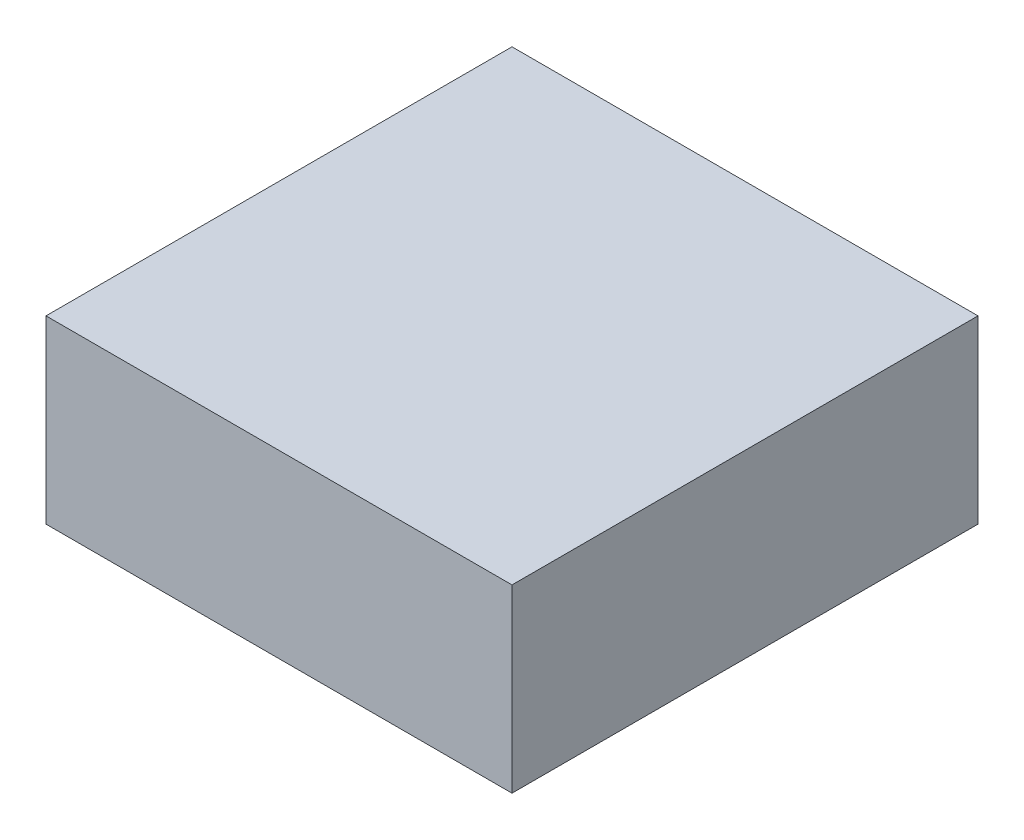
from build123d import *

# Parameters (mm, degrees)
SKETCH1_W             = 31
SKETCH1_H             = 31
BOSS_EXTRUDE1_DEPTH   = 12
CAVITY1_OUTLINE_W     = 27
CAVITY1_OUTLINE_H     = 27
CAVITY1_OUTLINE_W_2   = 23
CAVITY1_OUTLINE_H_2   = 23
CAVITY1_DEPTH         = 8
CAVITY1_2_OUTLINE_W   = 23
CAVITY1_2_OUTLINE_H   = 23
CAVITY1_2_OUTLINE_R   = 1.125
CAVITY1_2_DEPTH       = 2
CAVITY1_START         = 2
CAVITY1_3_OUTLINE_R   = 1.625
CAVITY1_3_OUTLINE_R_2 = 1.125
CAVITY1_3_DEPTH       = 1.2499999


with BuildPart() as part:
    # Sketch1 → Boss-Extrude1 (new body)
    with BuildSketch(Plane(origin=(0, 0, 0), x_dir=(1, 0, 0), z_dir=(0, 1, 0))):
        Rectangle(SKETCH1_W, SKETCH1_H)
    extrude(amount=BOSS_EXTRUDE1_DEPTH)

    # Cavity1: read off the stored shape, not the designer's step
    # Cavity1 outline → Cavity1 (cut)
    with BuildSketch(Plane(origin=(0, 0, 0), x_dir=(1, 0, 0), z_dir=(0, 1, 0))):
        with Locations((-0.219686861, -0.016298962)):
            Rectangle(CAVITY1_OUTLINE_W, CAVITY1_OUTLINE_H)
        with Locations((-0.219686861, -0.016298962)):
            Rectangle(CAVITY1_OUTLINE_W_2, CAVITY1_OUTLINE_H_2, mode=Mode.SUBTRACT)
    extrude(amount=CAVITY1_DEPTH, mode=Mode.SUBTRACT)

    # Cavity1 2 outline → Cavity1 2 (cut)
    with BuildSketch(Plane(origin=(0, 0, 0), x_dir=(1, 0, 0), z_dir=(0, 1, 0))):
        with Locations((-0.219686861, -0.016298962)):
            Rectangle(CAVITY1_2_OUTLINE_W, CAVITY1_2_OUTLINE_H)
        with Locations((-8.219686861, -8.016298962)):
            Circle(CAVITY1_2_OUTLINE_R, mode=Mode.SUBTRACT)
        with Locations((-4.219686861, -8.016298962)):
            Circle(CAVITY1_2_OUTLINE_R, mode=Mode.SUBTRACT)
        with Locations((-8.219686861, -4.016298962)):
            Circle(CAVITY1_2_OUTLINE_R, mode=Mode.SUBTRACT)
        with Locations((-4.219686861, -4.016298962)):
            Circle(CAVITY1_2_OUTLINE_R, mode=Mode.SUBTRACT)
        with Locations((-0.219686861, -8.016298962)):
            Circle(CAVITY1_2_OUTLINE_R, mode=Mode.SUBTRACT)
        with Locations((3.780313139, -8.016298962)):
            Circle(CAVITY1_2_OUTLINE_R, mode=Mode.SUBTRACT)
        with Locations((7.780313139, -8.016298962)):
            Circle(CAVITY1_2_OUTLINE_R, mode=Mode.SUBTRACT)
        with Locations((-0.219686861, -4.016298962)):
            Circle(CAVITY1_2_OUTLINE_R, mode=Mode.SUBTRACT)
        with Locations((3.780313139, -4.016298962)):
            Circle(CAVITY1_2_OUTLINE_R, mode=Mode.SUBTRACT)
        with Locations((7.780313139, -4.016298962)):
            Circle(CAVITY1_2_OUTLINE_R, mode=Mode.SUBTRACT)
        with Locations((-8.219686861, -0.016298962)):
            Circle(CAVITY1_2_OUTLINE_R, mode=Mode.SUBTRACT)
        with Locations((-8.219686861, 3.983701038)):
            Circle(CAVITY1_2_OUTLINE_R, mode=Mode.SUBTRACT)
        with Locations((-4.219686861, -0.016298962)):
            Circle(CAVITY1_2_OUTLINE_R, mode=Mode.SUBTRACT)
        with Locations((-4.219686861, 3.983701038)):
            Circle(CAVITY1_2_OUTLINE_R, mode=Mode.SUBTRACT)
        with Locations((-8.219686861, 7.983701038)):
            Circle(CAVITY1_2_OUTLINE_R, mode=Mode.SUBTRACT)
        with Locations((-4.219686861, 7.983701038)):
            Circle(CAVITY1_2_OUTLINE_R, mode=Mode.SUBTRACT)
        with Locations((-0.219686861, -0.016298962)):
            Circle(CAVITY1_2_OUTLINE_R, mode=Mode.SUBTRACT)
        with Locations((3.780313139, -0.016298962)):
            Circle(CAVITY1_2_OUTLINE_R, mode=Mode.SUBTRACT)
        with Locations((-0.219686861, 3.983701038)):
            Circle(CAVITY1_2_OUTLINE_R, mode=Mode.SUBTRACT)
        with Locations((3.780313139, 3.983701038)):
            Circle(CAVITY1_2_OUTLINE_R, mode=Mode.SUBTRACT)
        with Locations((7.780313139, -0.016298962)):
            Circle(CAVITY1_2_OUTLINE_R, mode=Mode.SUBTRACT)
        with Locations((7.780313139, 3.983701038)):
            Circle(CAVITY1_2_OUTLINE_R, mode=Mode.SUBTRACT)
        with Locations((-0.219686861, 7.983701038)):
            Circle(CAVITY1_2_OUTLINE_R, mode=Mode.SUBTRACT)
        with Locations((3.780313139, 7.983701038)):
            Circle(CAVITY1_2_OUTLINE_R, mode=Mode.SUBTRACT)
        with Locations((7.780313139, 7.983701038)):
            Circle(CAVITY1_2_OUTLINE_R, mode=Mode.SUBTRACT)
    extrude(amount=CAVITY1_2_DEPTH, mode=Mode.SUBTRACT)

    # Cavity1 3 outline → Cavity1 3 (cut)
    # profile 1 of 25: a face of its own
    with BuildSketch(Plane(origin=(0, 0, 0), x_dir=(1, 0, 0), z_dir=(0, 1, 0)).offset(CAVITY1_START)):
        with Locations((7.780313139, 7.983701038)):
            Circle(CAVITY1_3_OUTLINE_R)
        with Locations((7.780313139, 7.983701038)):
            Circle(CAVITY1_3_OUTLINE_R_2, mode=Mode.SUBTRACT)
    # profile 2 of 25: a face of its own
    with BuildSketch(Plane(origin=(0, 0, 0), x_dir=(1, 0, 0), z_dir=(0, 1, 0)).offset(CAVITY1_START)):
        with Locations((3.780313139, 7.983701038)):
            Circle(CAVITY1_3_OUTLINE_R)
        with Locations((3.780313139, 7.983701038)):
            Circle(CAVITY1_3_OUTLINE_R_2, mode=Mode.SUBTRACT)
    # profile 3 of 25: a face of its own
    with BuildSketch(Plane(origin=(0, 0, 0), x_dir=(1, 0, 0), z_dir=(0, 1, 0)).offset(CAVITY1_START)):
        with Locations((-0.219686861, 7.983701038)):
            Circle(CAVITY1_3_OUTLINE_R)
        with Locations((-0.219686861, 7.983701038)):
            Circle(CAVITY1_3_OUTLINE_R_2, mode=Mode.SUBTRACT)
    # profile 4 of 25: a face of its own
    with BuildSketch(Plane(origin=(0, 0, 0), x_dir=(1, 0, 0), z_dir=(0, 1, 0)).offset(CAVITY1_START)):
        with Locations((-4.219686861, 7.983701038)):
            Circle(CAVITY1_3_OUTLINE_R)
        with Locations((-4.219686861, 7.983701038)):
            Circle(CAVITY1_3_OUTLINE_R_2, mode=Mode.SUBTRACT)
    # profile 5 of 25: a face of its own
    with BuildSketch(Plane(origin=(0, 0, 0), x_dir=(1, 0, 0), z_dir=(0, 1, 0)).offset(CAVITY1_START)):
        with Locations((-8.219686861, 7.983701038)):
            Circle(CAVITY1_3_OUTLINE_R)
        with Locations((-8.219686861, 7.983701038)):
            Circle(CAVITY1_3_OUTLINE_R_2, mode=Mode.SUBTRACT)
    # profile 6 of 25: a face of its own
    with BuildSketch(Plane(origin=(0, 0, 0), x_dir=(1, 0, 0), z_dir=(0, 1, 0)).offset(CAVITY1_START)):
        with Locations((7.780313139, 3.983701038)):
            Circle(CAVITY1_3_OUTLINE_R)
        with Locations((7.780313139, 3.983701038)):
            Circle(CAVITY1_3_OUTLINE_R_2, mode=Mode.SUBTRACT)
    # profile 7 of 25: a face of its own
    with BuildSketch(Plane(origin=(0, 0, 0), x_dir=(1, 0, 0), z_dir=(0, 1, 0)).offset(CAVITY1_START)):
        with Locations((3.780313139, 3.983701038)):
            Circle(CAVITY1_3_OUTLINE_R)
        with Locations((3.780313139, 3.983701038)):
            Circle(CAVITY1_3_OUTLINE_R_2, mode=Mode.SUBTRACT)
    # profile 8 of 25: a face of its own
    with BuildSketch(Plane(origin=(0, 0, 0), x_dir=(1, 0, 0), z_dir=(0, 1, 0)).offset(CAVITY1_START)):
        with Locations((-0.219686861, 3.983701038)):
            Circle(CAVITY1_3_OUTLINE_R)
        with Locations((-0.219686861, 3.983701038)):
            Circle(CAVITY1_3_OUTLINE_R_2, mode=Mode.SUBTRACT)
    # profile 9 of 25: a face of its own
    with BuildSketch(Plane(origin=(0, 0, 0), x_dir=(1, 0, 0), z_dir=(0, 1, 0)).offset(CAVITY1_START)):
        with Locations((-4.219686861, 3.983701038)):
            Circle(CAVITY1_3_OUTLINE_R)
        with Locations((-4.219686861, 3.983701038)):
            Circle(CAVITY1_3_OUTLINE_R_2, mode=Mode.SUBTRACT)
    # profile 10 of 25: a face of its own
    with BuildSketch(Plane(origin=(0, 0, 0), x_dir=(1, 0, 0), z_dir=(0, 1, 0)).offset(CAVITY1_START)):
        with Locations((-8.219686861, 3.983701038)):
            Circle(CAVITY1_3_OUTLINE_R)
        with Locations((-8.219686861, 3.983701038)):
            Circle(CAVITY1_3_OUTLINE_R_2, mode=Mode.SUBTRACT)
    # profile 11 of 25: a face of its own
    with BuildSketch(Plane(origin=(0, 0, 0), x_dir=(1, 0, 0), z_dir=(0, 1, 0)).offset(CAVITY1_START)):
        with Locations((7.780313139, -0.016298962)):
            Circle(CAVITY1_3_OUTLINE_R)
        with Locations((7.780313139, -0.016298962)):
            Circle(CAVITY1_3_OUTLINE_R_2, mode=Mode.SUBTRACT)
    # profile 12 of 25: a face of its own
    with BuildSketch(Plane(origin=(0, 0, 0), x_dir=(1, 0, 0), z_dir=(0, 1, 0)).offset(CAVITY1_START)):
        with Locations((3.780313139, -0.016298962)):
            Circle(CAVITY1_3_OUTLINE_R)
        with Locations((3.780313139, -0.016298962)):
            Circle(CAVITY1_3_OUTLINE_R_2, mode=Mode.SUBTRACT)
    # profile 13 of 25: a face of its own
    with BuildSketch(Plane(origin=(0, 0, 0), x_dir=(1, 0, 0), z_dir=(0, 1, 0)).offset(CAVITY1_START)):
        with Locations((-0.219686861, -0.016298962)):
            Circle(CAVITY1_3_OUTLINE_R)
        with Locations((-0.219686861, -0.016298962)):
            Circle(CAVITY1_3_OUTLINE_R_2, mode=Mode.SUBTRACT)
    # profile 14 of 25: a face of its own
    with BuildSketch(Plane(origin=(0, 0, 0), x_dir=(1, 0, 0), z_dir=(0, 1, 0)).offset(CAVITY1_START)):
        with Locations((-4.219686861, -0.016298962)):
            Circle(CAVITY1_3_OUTLINE_R)
        with Locations((-4.219686861, -0.016298962)):
            Circle(CAVITY1_3_OUTLINE_R_2, mode=Mode.SUBTRACT)
    # profile 15 of 25: a face of its own
    with BuildSketch(Plane(origin=(0, 0, 0), x_dir=(1, 0, 0), z_dir=(0, 1, 0)).offset(CAVITY1_START)):
        with Locations((-8.219686861, -0.016298962)):
            Circle(CAVITY1_3_OUTLINE_R)
        with Locations((-8.219686861, -0.016298962)):
            Circle(CAVITY1_3_OUTLINE_R_2, mode=Mode.SUBTRACT)
    # profile 16 of 25: a face of its own
    with BuildSketch(Plane(origin=(0, 0, 0), x_dir=(1, 0, 0), z_dir=(0, 1, 0)).offset(CAVITY1_START)):
        with Locations((7.780313139, -4.016298962)):
            Circle(CAVITY1_3_OUTLINE_R)
        with Locations((7.780313139, -4.016298962)):
            Circle(CAVITY1_3_OUTLINE_R_2, mode=Mode.SUBTRACT)
    # profile 17 of 25: a face of its own
    with BuildSketch(Plane(origin=(0, 0, 0), x_dir=(1, 0, 0), z_dir=(0, 1, 0)).offset(CAVITY1_START)):
        with Locations((3.780313139, -4.016298962)):
            Circle(CAVITY1_3_OUTLINE_R)
        with Locations((3.780313139, -4.016298962)):
            Circle(CAVITY1_3_OUTLINE_R_2, mode=Mode.SUBTRACT)
    # profile 18 of 25: a face of its own
    with BuildSketch(Plane(origin=(0, 0, 0), x_dir=(1, 0, 0), z_dir=(0, 1, 0)).offset(CAVITY1_START)):
        with Locations((-0.219686861, -4.016298962)):
            Circle(CAVITY1_3_OUTLINE_R)
        with Locations((-0.219686861, -4.016298962)):
            Circle(CAVITY1_3_OUTLINE_R_2, mode=Mode.SUBTRACT)
    # profile 19 of 25: a face of its own
    with BuildSketch(Plane(origin=(0, 0, 0), x_dir=(1, 0, 0), z_dir=(0, 1, 0)).offset(CAVITY1_START)):
        with Locations((-4.219686861, -4.016298962)):
            Circle(CAVITY1_3_OUTLINE_R)
        with Locations((-4.219686861, -4.016298962)):
            Circle(CAVITY1_3_OUTLINE_R_2, mode=Mode.SUBTRACT)
    # profile 20 of 25: a face of its own
    with BuildSketch(Plane(origin=(0, 0, 0), x_dir=(1, 0, 0), z_dir=(0, 1, 0)).offset(CAVITY1_START)):
        with Locations((-8.219686861, -4.016298962)):
            Circle(CAVITY1_3_OUTLINE_R)
        with Locations((-8.219686861, -4.016298962)):
            Circle(CAVITY1_3_OUTLINE_R_2, mode=Mode.SUBTRACT)
    # profile 21 of 25: a face of its own
    with BuildSketch(Plane(origin=(0, 0, 0), x_dir=(1, 0, 0), z_dir=(0, 1, 0)).offset(CAVITY1_START)):
        with Locations((7.780313139, -8.016298962)):
            Circle(CAVITY1_3_OUTLINE_R)
        with Locations((7.780313139, -8.016298962)):
            Circle(CAVITY1_3_OUTLINE_R_2, mode=Mode.SUBTRACT)
    # profile 22 of 25: a face of its own
    with BuildSketch(Plane(origin=(0, 0, 0), x_dir=(1, 0, 0), z_dir=(0, 1, 0)).offset(CAVITY1_START)):
        with Locations((3.780313139, -8.016298962)):
            Circle(CAVITY1_3_OUTLINE_R)
        with Locations((3.780313139, -8.016298962)):
            Circle(CAVITY1_3_OUTLINE_R_2, mode=Mode.SUBTRACT)
    # profile 23 of 25: a face of its own
    with BuildSketch(Plane(origin=(0, 0, 0), x_dir=(1, 0, 0), z_dir=(0, 1, 0)).offset(CAVITY1_START)):
        with Locations((-0.219686861, -8.016298962)):
            Circle(CAVITY1_3_OUTLINE_R)
        with Locations((-0.219686861, -8.016298962)):
            Circle(CAVITY1_3_OUTLINE_R_2, mode=Mode.SUBTRACT)
    # profile 24 of 25: a face of its own
    with BuildSketch(Plane(origin=(0, 0, 0), x_dir=(1, 0, 0), z_dir=(0, 1, 0)).offset(CAVITY1_START)):
        with Locations((-4.219686861, -8.016298962)):
            Circle(CAVITY1_3_OUTLINE_R)
        with Locations((-4.219686861, -8.016298962)):
            Circle(CAVITY1_3_OUTLINE_R_2, mode=Mode.SUBTRACT)
    # profile 25 of 25: a face of its own
    with BuildSketch(Plane(origin=(0, 0, 0), x_dir=(1, 0, 0), z_dir=(0, 1, 0)).offset(CAVITY1_START)):
        with Locations((-8.219686861, -8.016298962)):
            Circle(CAVITY1_3_OUTLINE_R)
        with Locations((-8.219686861, -8.016298962)):
            Circle(CAVITY1_3_OUTLINE_R_2, mode=Mode.SUBTRACT)
    extrude(amount=CAVITY1_3_DEPTH, mode=Mode.SUBTRACT)

    # Cavity1 4 outline → Cavity1 4 (revolve, cut)
    with BuildSketch(Plane(origin=(7.780313139, 0, -7.983701038), x_dir=(1, 0, 0), z_dir=(0, 0, 1))):
        with BuildLine():
            ThreePointArc((1.625, 3.25), (1.551776695, 3.426776695), (1.375, 3.5))
            ThreePointArc((1.375, 3.5), (1.198223305, 3.426776695), (1.125, 3.25))
            Line((1.125, 3.25), (1.625, 3.25))
        make_face()
    revolve(axis=Axis((7.780313139, 0, -7.983701038), (0, 1, 0)), mode=Mode.SUBTRACT)

    # Cavity1 5 outline → Cavity1 5 (revolve, cut)
    with BuildSketch(Plane(origin=(3.780313139, 0, -7.983701038), x_dir=(1, 0, 0), z_dir=(0, 0, 1))):
        with BuildLine():
            ThreePointArc((1.625, 3.25), (1.551776695, 3.426776695), (1.375, 3.5))
            ThreePointArc((1.375, 3.5), (1.198223305, 3.426776695), (1.125, 3.25))
            Line((1.125, 3.25), (1.625, 3.25))
        make_face()
    revolve(axis=Axis((3.780313139, 0, -7.983701038), (0, 1, 0)), mode=Mode.SUBTRACT)

    # Cavity1 6 outline → Cavity1 6 (revolve, cut)
    with BuildSketch(Plane(origin=(-0.219686861, 0, -7.983701038), x_dir=(1, 0, 0), z_dir=(0, 0, 1))):
        with BuildLine():
            ThreePointArc((1.625, 3.25), (1.551776695, 3.426776695), (1.375, 3.5))
            ThreePointArc((1.375, 3.5), (1.198223305, 3.426776695), (1.125, 3.25))
            Line((1.125, 3.25), (1.625, 3.25))
        make_face()
    revolve(axis=Axis((-0.219686861, 0, -7.983701038), (0, 1, 0)), mode=Mode.SUBTRACT)

    # Cavity1 7 outline → Cavity1 7 (revolve, cut)
    with BuildSketch(Plane(origin=(-4.219686861, 0, -7.983701038), x_dir=(1, 0, 0), z_dir=(0, 0, 1))):
        with BuildLine():
            ThreePointArc((1.625, 3.25), (1.551776695, 3.426776695), (1.375, 3.5))
            ThreePointArc((1.375, 3.5), (1.198223305, 3.426776695), (1.125, 3.25))
            Line((1.125, 3.25), (1.625, 3.25))
        make_face()
    revolve(axis=Axis((-4.219686861, 0, -7.983701038), (0, 1, 0)), mode=Mode.SUBTRACT)

    # Cavity1 8 outline → Cavity1 8 (revolve, cut)
    with BuildSketch(Plane(origin=(-8.219686861, 0, -7.983701038), x_dir=(1, 0, 0), z_dir=(0, 0, 1))):
        with BuildLine():
            ThreePointArc((1.625, 3.25), (1.551776695, 3.426776695), (1.375, 3.5))
            ThreePointArc((1.375, 3.5), (1.198223305, 3.426776695), (1.125, 3.25))
            Line((1.125, 3.25), (1.625, 3.25))
        make_face()
    revolve(axis=Axis((-8.219686861, 0, -7.983701038), (0, 1, 0)), mode=Mode.SUBTRACT)

    # Cavity1 9 outline → Cavity1 9 (revolve, cut)
    with BuildSketch(Plane(origin=(7.780313139, 0, -3.983701038), x_dir=(1, 0, 0), z_dir=(0, 0, 1))):
        with BuildLine():
            ThreePointArc((1.625, 3.25), (1.551776695, 3.426776695), (1.375, 3.5))
            ThreePointArc((1.375, 3.5), (1.198223305, 3.426776695), (1.125, 3.25))
            Line((1.125, 3.25), (1.625, 3.25))
        make_face()
    revolve(axis=Axis((7.780313139, 0, -3.983701038), (0, 1, 0)), mode=Mode.SUBTRACT)

    # Cavity1 10 outline → Cavity1 10 (revolve, cut)
    with BuildSketch(Plane(origin=(3.780313139, 0, -3.983701038), x_dir=(1, 0, 0), z_dir=(0, 0, 1))):
        with BuildLine():
            ThreePointArc((1.625, 3.25), (1.551776695, 3.426776695), (1.375, 3.5))
            ThreePointArc((1.375, 3.5), (1.198223305, 3.426776695), (1.125, 3.25))
            Line((1.125, 3.25), (1.625, 3.25))
        make_face()
    revolve(axis=Axis((3.780313139, 0, -3.983701038), (0, 1, 0)), mode=Mode.SUBTRACT)

    # Cavity1 11 outline → Cavity1 11 (revolve, cut)
    with BuildSketch(Plane(origin=(-0.219686861, 0, -3.983701038), x_dir=(1, 0, 0), z_dir=(0, 0, 1))):
        with BuildLine():
            ThreePointArc((1.625, 3.25), (1.551776695, 3.426776695), (1.375, 3.5))
            ThreePointArc((1.375, 3.5), (1.198223305, 3.426776695), (1.125, 3.25))
            Line((1.125, 3.25), (1.625, 3.25))
        make_face()
    revolve(axis=Axis((-0.219686861, 0, -3.983701038), (0, 1, 0)), mode=Mode.SUBTRACT)

    # Cavity1 12 outline → Cavity1 12 (revolve, cut)
    with BuildSketch(Plane(origin=(-4.219686861, 0, -3.983701038), x_dir=(1, 0, 0), z_dir=(0, 0, 1))):
        with BuildLine():
            ThreePointArc((1.625, 3.25), (1.551776695, 3.426776695), (1.375, 3.5))
            ThreePointArc((1.375, 3.5), (1.198223305, 3.426776695), (1.125, 3.25))
            Line((1.125, 3.25), (1.625, 3.25))
        make_face()
    revolve(axis=Axis((-4.219686861, 0, -3.983701038), (0, 1, 0)), mode=Mode.SUBTRACT)

    # Cavity1 13 outline → Cavity1 13 (revolve, cut)
    with BuildSketch(Plane(origin=(-8.219686861, 0, -3.983701038), x_dir=(1, 0, 0), z_dir=(0, 0, 1))):
        with BuildLine():
            ThreePointArc((1.625, 3.25), (1.551776695, 3.426776695), (1.375, 3.5))
            ThreePointArc((1.375, 3.5), (1.198223305, 3.426776695), (1.125, 3.25))
            Line((1.125, 3.25), (1.625, 3.25))
        make_face()
    revolve(axis=Axis((-8.219686861, 0, -3.983701038), (0, 1, 0)), mode=Mode.SUBTRACT)

    # Cavity1 14 outline → Cavity1 14 (revolve, cut)
    with BuildSketch(Plane(origin=(7.780313139, 0, 0.016298962), x_dir=(1, 0, 0), z_dir=(0, 0, 1))):
        with BuildLine():
            ThreePointArc((1.625, 3.25), (1.551776695, 3.426776695), (1.375, 3.5))
            ThreePointArc((1.375, 3.5), (1.198223305, 3.426776695), (1.125, 3.25))
            Line((1.125, 3.25), (1.625, 3.25))
        make_face()
    revolve(axis=Axis((7.780313139, 0, 0.016298962), (0, 1, 0)), mode=Mode.SUBTRACT)

    # Cavity1 15 outline → Cavity1 15 (revolve, cut)
    with BuildSketch(Plane(origin=(3.780313139, 0, 0.016298962), x_dir=(1, 0, 0), z_dir=(0, 0, 1))):
        with BuildLine():
            ThreePointArc((1.625, 3.25), (1.551776695, 3.426776695), (1.375, 3.5))
            ThreePointArc((1.375, 3.5), (1.198223305, 3.426776695), (1.125, 3.25))
            Line((1.125, 3.25), (1.625, 3.25))
        make_face()
    revolve(axis=Axis((3.780313139, 0, 0.016298962), (0, 1, 0)), mode=Mode.SUBTRACT)

    # Cavity1 16 outline → Cavity1 16 (revolve, cut)
    with BuildSketch(Plane(origin=(-0.219686861, 0, 0.016298962), x_dir=(1, 0, 0), z_dir=(0, 0, 1))):
        with BuildLine():
            ThreePointArc((1.625, 3.25), (1.551776695, 3.426776695), (1.375, 3.5))
            ThreePointArc((1.375, 3.5), (1.198223305, 3.426776695), (1.125, 3.25))
            Line((1.125, 3.25), (1.625, 3.25))
        make_face()
    revolve(axis=Axis((-0.219686861, 0, 0.016298962), (0, 1, 0)), mode=Mode.SUBTRACT)

    # Cavity1 17 outline → Cavity1 17 (revolve, cut)
    with BuildSketch(Plane(origin=(-4.219686861, 0, 0.016298962), x_dir=(1, 0, 0), z_dir=(0, 0, 1))):
        with BuildLine():
            ThreePointArc((1.625, 3.25), (1.551776695, 3.426776695), (1.375, 3.5))
            ThreePointArc((1.375, 3.5), (1.198223305, 3.426776695), (1.125, 3.25))
            Line((1.125, 3.25), (1.625, 3.25))
        make_face()
    revolve(axis=Axis((-4.219686861, 0, 0.016298962), (0, 1, 0)), mode=Mode.SUBTRACT)

    # Cavity1 18 outline → Cavity1 18 (revolve, cut)
    with BuildSketch(Plane(origin=(-8.219686861, 0, 0.016298962), x_dir=(1, 0, 0), z_dir=(0, 0, 1))):
        with BuildLine():
            ThreePointArc((1.625, 3.25), (1.551776695, 3.426776695), (1.375, 3.5))
            ThreePointArc((1.375, 3.5), (1.198223305, 3.426776695), (1.125, 3.25))
            Line((1.125, 3.25), (1.625, 3.25))
        make_face()
    revolve(axis=Axis((-8.219686861, 0, 0.016298962), (0, 1, 0)), mode=Mode.SUBTRACT)

    # Cavity1 19 outline → Cavity1 19 (revolve, cut)
    with BuildSketch(Plane(origin=(7.780313139, 0, 4.016298962), x_dir=(1, 0, 0), z_dir=(0, 0, 1))):
        with BuildLine():
            ThreePointArc((1.625, 3.25), (1.551776695, 3.426776695), (1.375, 3.5))
            ThreePointArc((1.375, 3.5), (1.198223305, 3.426776695), (1.125, 3.25))
            Line((1.125, 3.25), (1.625, 3.25))
        make_face()
    revolve(axis=Axis((7.780313139, 0, 4.016298962), (0, 1, 0)), mode=Mode.SUBTRACT)

    # Cavity1 20 outline → Cavity1 20 (revolve, cut)
    with BuildSketch(Plane(origin=(3.780313139, 0, 4.016298962), x_dir=(1, 0, 0), z_dir=(0, 0, 1))):
        with BuildLine():
            ThreePointArc((1.625, 3.25), (1.551776695, 3.426776695), (1.375, 3.5))
            ThreePointArc((1.375, 3.5), (1.198223305, 3.426776695), (1.125, 3.25))
            Line((1.125, 3.25), (1.625, 3.25))
        make_face()
    revolve(axis=Axis((3.780313139, 0, 4.016298962), (0, 1, 0)), mode=Mode.SUBTRACT)

    # Cavity1 21 outline → Cavity1 21 (revolve, cut)
    with BuildSketch(Plane(origin=(-0.219686861, 0, 4.016298962), x_dir=(1, 0, 0), z_dir=(0, 0, 1))):
        with BuildLine():
            ThreePointArc((1.625, 3.25), (1.551776695, 3.426776695), (1.375, 3.5))
            ThreePointArc((1.375, 3.5), (1.198223305, 3.426776695), (1.125, 3.25))
            Line((1.125, 3.25), (1.625, 3.25))
        make_face()
    revolve(axis=Axis((-0.219686861, 0, 4.016298962), (0, 1, 0)), mode=Mode.SUBTRACT)

    # Cavity1 22 outline → Cavity1 22 (revolve, cut)
    with BuildSketch(Plane(origin=(-4.219686861, 0, 4.016298962), x_dir=(1, 0, 0), z_dir=(0, 0, 1))):
        with BuildLine():
            ThreePointArc((1.625, 3.25), (1.551776695, 3.426776695), (1.375, 3.5))
            ThreePointArc((1.375, 3.5), (1.198223305, 3.426776695), (1.125, 3.25))
            Line((1.125, 3.25), (1.625, 3.25))
        make_face()
    revolve(axis=Axis((-4.219686861, 0, 4.016298962), (0, 1, 0)), mode=Mode.SUBTRACT)

    # Cavity1 23 outline → Cavity1 23 (revolve, cut)
    with BuildSketch(Plane(origin=(-8.219686861, 0, 4.016298962), x_dir=(1, 0, 0), z_dir=(0, 0, 1))):
        with BuildLine():
            ThreePointArc((1.625, 3.25), (1.551776695, 3.426776695), (1.375, 3.5))
            ThreePointArc((1.375, 3.5), (1.198223305, 3.426776695), (1.125, 3.25))
            Line((1.125, 3.25), (1.625, 3.25))
        make_face()
    revolve(axis=Axis((-8.219686861, 0, 4.016298962), (0, 1, 0)), mode=Mode.SUBTRACT)

    # Cavity1 24 outline → Cavity1 24 (revolve, cut)
    with BuildSketch(Plane(origin=(7.780313139, 0, 8.016298962), x_dir=(1, 0, 0), z_dir=(0, 0, 1))):
        with BuildLine():
            ThreePointArc((1.625, 3.25), (1.551776695, 3.426776695), (1.375, 3.5))
            ThreePointArc((1.375, 3.5), (1.198223305, 3.426776695), (1.125, 3.25))
            Line((1.125, 3.25), (1.625, 3.25))
        make_face()
    revolve(axis=Axis((7.780313139, 0, 8.016298962), (0, 1, 0)), mode=Mode.SUBTRACT)

    # Cavity1 25 outline → Cavity1 25 (revolve, cut)
    with BuildSketch(Plane(origin=(3.780313139, 0, 8.016298962), x_dir=(1, 0, 0), z_dir=(0, 0, 1))):
        with BuildLine():
            ThreePointArc((1.625, 3.25), (1.551776695, 3.426776695), (1.375, 3.5))
            ThreePointArc((1.375, 3.5), (1.198223305, 3.426776695), (1.125, 3.25))
            Line((1.125, 3.25), (1.625, 3.25))
        make_face()
    revolve(axis=Axis((3.780313139, 0, 8.016298962), (0, 1, 0)), mode=Mode.SUBTRACT)

    # Cavity1 26 outline → Cavity1 26 (revolve, cut)
    with BuildSketch(Plane(origin=(-0.219686861, 0, 8.016298962), x_dir=(1, 0, 0), z_dir=(0, 0, 1))):
        with BuildLine():
            ThreePointArc((1.625, 3.25), (1.551776695, 3.426776695), (1.375, 3.5))
            ThreePointArc((1.375, 3.5), (1.198223305, 3.426776695), (1.125, 3.25))
            Line((1.125, 3.25), (1.625, 3.25))
        make_face()
    revolve(axis=Axis((-0.219686861, 0, 8.016298962), (0, 1, 0)), mode=Mode.SUBTRACT)

    # Cavity1 27 outline → Cavity1 27 (revolve, cut)
    with BuildSketch(Plane(origin=(-4.219686861, 0, 8.016298962), x_dir=(1, 0, 0), z_dir=(0, 0, 1))):
        with BuildLine():
            ThreePointArc((1.625, 3.25), (1.551776695, 3.426776695), (1.375, 3.5))
            ThreePointArc((1.375, 3.5), (1.198223305, 3.426776695), (1.125, 3.25))
            Line((1.125, 3.25), (1.625, 3.25))
        make_face()
    revolve(axis=Axis((-4.219686861, 0, 8.016298962), (0, 1, 0)), mode=Mode.SUBTRACT)

    # Cavity1 28 outline → Cavity1 28 (revolve, cut)
    with BuildSketch(Plane(origin=(-8.219686861, 0, 8.016298962), x_dir=(1, 0, 0), z_dir=(0, 0, 1))):
        with BuildLine():
            ThreePointArc((1.625, 3.25), (1.551776695, 3.426776695), (1.375, 3.5))
            ThreePointArc((1.375, 3.5), (1.198223305, 3.426776695), (1.125, 3.25))
            Line((1.125, 3.25), (1.625, 3.25))
        make_face()
    revolve(axis=Axis((-8.219686861, 0, 8.016298962), (0, 1, 0)), mode=Mode.SUBTRACT)


solid = part.part
